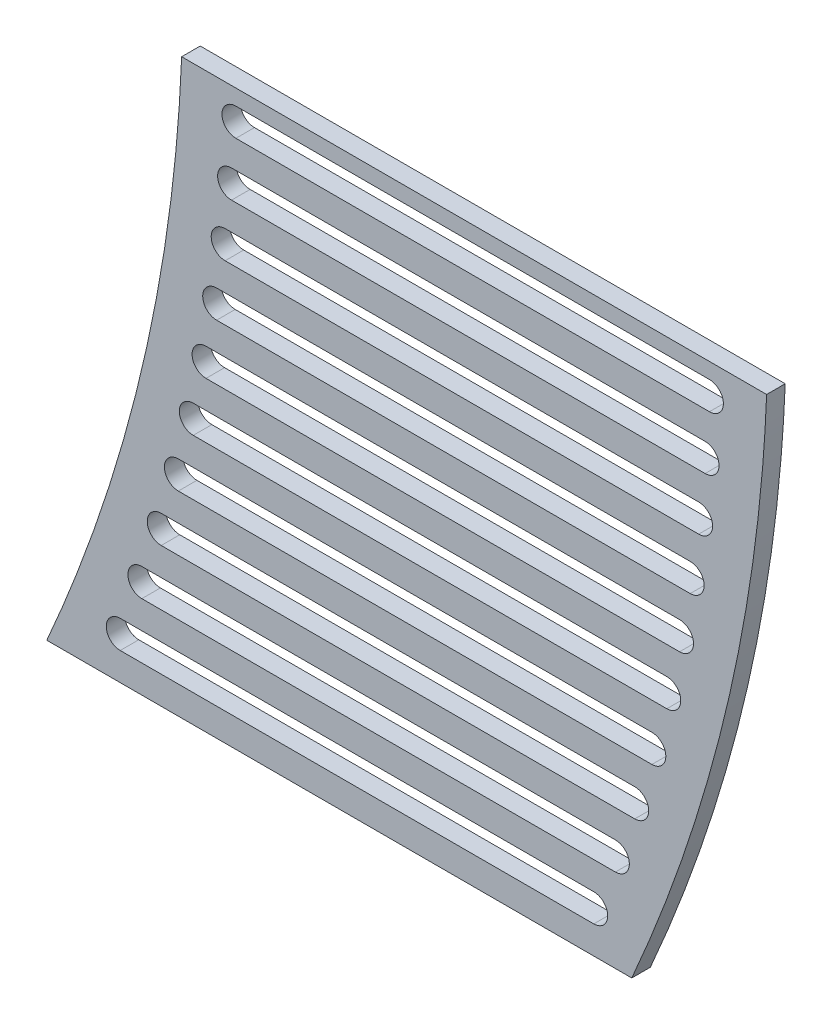
from build123d import *

# Parameters (mm, degrees)
BOSS_EXTRUDE1_DEPTH = 2.54
CUT_EXTRUDE1_DEPTH  = 126.848428748
LPATTERN1_DEPTH     = 2.54


# Read off the part's stored shape, not the designer's step: LPattern1
with BuildPart() as part:
    # Sketch1 → Boss-Extrude1 (new body)
    with BuildSketch(Plane.XY):
        with BuildLine():
            Line((0, 0), (80.01, 0))
            add(Edge.make_bspline(
                [(80.01, 0), (96.839490245, 38.288168981), (98.456742521, 78.343125)],
                knots=[0, 0, 0, 0.824657213, 0.824657213, 0.824657213], degree=2))
            Line((98.456742521, 78.343125), (18.446742521, 78.343125))
            add(Edge.make_bspline(
                [(0, 0), (16.829490245, 38.288168981), (18.446742521, 78.343125)],
                knots=[0, 0, 0, 0.824657213, 0.824657213, 0.824657213], degree=2))
        make_face()
    extrude(amount=BOSS_EXTRUDE1_DEPTH)

    # Sketch2 → Cut-Extrude1 (cut, through all)
    with BuildSketch(Plane.XY.offset(2.54)):
        with BuildLine():
            Line((10.043267201, 7.62), (74.813267201, 7.62))
            ThreePointArc((74.813267201, 7.62), (76.718267201, 5.715), (74.813267201, 3.81))
            Line((74.813267201, 3.81), (10.043267201, 3.81))
            ThreePointArc((10.043267201, 3.81), (8.138267201, 5.715), (10.043267201, 7.62))
        make_face()
    extrude(amount=-CUT_EXTRUDE1_DEPTH, mode=Mode.SUBTRACT)

    # LPattern1 outline → LPattern1 (cut)
    with BuildSketch(Plane.XY):
        with BuildLine():
            Line((77.770374016, 15.24), (13.000374016, 15.24))
            ThreePointArc((13.000374016, 15.24), (11.095374016, 13.335), (13.000374016, 11.43))
            Line((13.000374016, 11.43), (77.770374016, 11.43))
            ThreePointArc((77.770374016, 11.43), (79.675374016, 13.335), (77.770374016, 15.24))
        make_face()
        with BuildLine():
            Line((80.418314493, 22.86), (15.648314493, 22.86))
            ThreePointArc((15.648314493, 22.86), (13.743314493, 20.955), (15.648314493, 19.05))
            Line((15.648314493, 19.05), (80.418314493, 19.05))
            ThreePointArc((80.418314493, 19.05), (82.323314493, 20.955), (80.418314493, 22.86))
        make_face()
        with BuildLine():
            Line((82.761233407, 30.48), (17.991233408, 30.48))
            ThreePointArc((17.991233408, 30.48), (16.086233408, 28.575), (17.991233408, 26.67))
            Line((17.991233408, 26.67), (82.761233407, 26.67))
            ThreePointArc((82.761233407, 26.67), (84.666233407, 28.575), (82.761233407, 30.48))
        make_face()
        with BuildLine():
            Line((84.803183747, 38.1), (20.033183747, 38.1))
            ThreePointArc((20.033183747, 38.1), (18.128183747, 36.195), (20.033183747, 34.29))
            Line((20.033183747, 34.29), (84.803183747, 34.29))
            ThreePointArc((84.803183747, 34.29), (86.708183747, 36.195), (84.803183747, 38.1))
        make_face()
        with BuildLine():
            Line((86.548129526, 45.72), (21.778129526, 45.72))
            ThreePointArc((21.778129526, 45.72), (19.873129526, 43.815), (21.778129526, 41.91))
            Line((21.778129526, 41.91), (86.548129526, 41.91))
            ThreePointArc((86.548129526, 41.91), (88.453129526, 43.815), (86.548129526, 45.72))
        make_face()
        with BuildLine():
            Line((87.999948503, 53.34), (23.229948503, 53.34))
            ThreePointArc((23.229948503, 53.34), (21.324948503, 51.435), (23.229948503, 49.53))
            Line((23.229948503, 49.53), (87.999948503, 49.53))
            ThreePointArc((87.999948503, 49.53), (89.904948503, 51.435), (87.999948503, 53.34))
        make_face()
        with BuildLine():
            Line((89.16243478, 60.96), (24.39243478, 60.96))
            ThreePointArc((24.39243478, 60.96), (22.48743478, 59.055), (24.39243478, 57.15))
            Line((24.39243478, 57.15), (89.16243478, 57.15))
            ThreePointArc((89.16243478, 57.15), (91.06743478, 59.055), (89.16243478, 60.96))
        make_face()
        with BuildLine():
            Line((90.039301311, 68.58), (25.269301311, 68.58))
            ThreePointArc((25.269301311, 68.58), (23.364301311, 66.675), (25.269301311, 64.77))
            Line((25.269301311, 64.77), (90.039301311, 64.77))
            ThreePointArc((90.039301311, 64.77), (91.944301311, 66.675), (90.039301311, 68.58))
        make_face()
        with BuildLine():
            Line((90.634182309, 76.2), (25.864182309, 76.2))
            ThreePointArc((25.864182309, 76.2), (23.959182309, 74.295), (25.864182309, 72.39))
            Line((25.864182309, 72.39), (90.634182309, 72.39))
            ThreePointArc((90.634182309, 72.39), (92.539182309, 74.295), (90.634182309, 76.2))
        make_face()
    extrude(amount=LPATTERN1_DEPTH, mode=Mode.SUBTRACT)


solid = part.part
